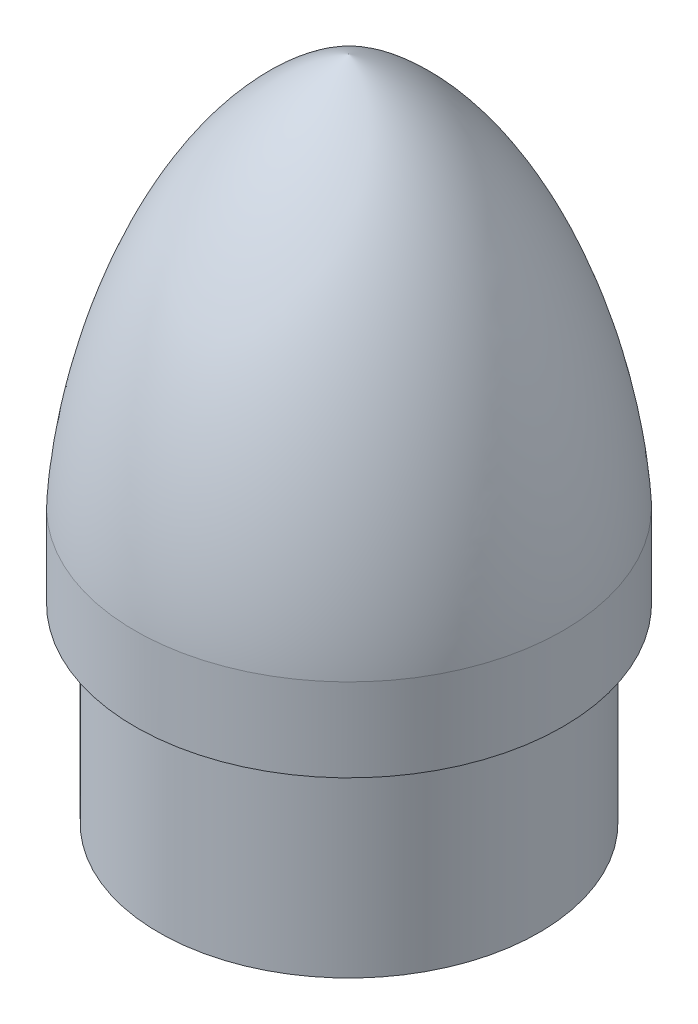
from build123d import *

# Parameters (mm, degrees)
SKETCH6_R           = 45
BOSS_EXTRUDE7_DEPTH = 100
SKETCH8_R           = 40
BOSS_EXTRUDE8_DEPTH = 40


with BuildPart() as part:
    # Sketch6 → Boss-Extrude7 (new body)
    with BuildSketch(Plane(origin=(0, 0, 0), x_dir=(1, 0, 0), z_dir=(0, 1, 0))):
        with Locations(Location((0, 0, 0), (0, 0, 270))):
            Circle(SKETCH6_R)
    extrude(amount=BOSS_EXTRUDE7_DEPTH)


with BuildPart() as body_2:
    # Sketch7 → Revolve2 (revolve)
    with BuildSketch(Plane.XY, mode=Mode.PRIVATE) as revolve2_sk:
        with BuildLine():
            Line((0, 100), (0, 125.083403494))
            Line((0, 125.083403494), (-88.216224583, 125.083403494))
            Line((-88.216224583, 125.083403494), (-88.216224583, 0))
            Line((-88.216224583, 0), (-45, 0))
            add(Edge.make_bspline(
                [(-45, 0), (-45.199870538, 9.069967987), (-45.686940304, 37.078388642), (-29.510811545, 88.131965608), (0, 100)],
                knots=[0, 0, 0, 0, 0.165319882, 1, 1, 1, 1], degree=3))
        make_face()
    revolve(revolve2_sk.sketch.rotate(Axis((0, 100, 0), (0, 1, 0)), 180), axis=Axis((0, 100, 0), (0, 1, 0)))


with BuildPart() as part_1:
    add(part.part)

    # Intersect1: read off the stored shape, not the designer's step
    # Intersect1: cut body 2
    add(body_2.part, mode=Mode.SUBTRACT)

    # Sketch8 → Boss-Extrude8 (add)
    with BuildSketch(Plane.XZ):
        with Locations(Location((0, 0, 0), (0, 0, 270))):
            Circle(SKETCH8_R)
    extrude(amount=BOSS_EXTRUDE8_DEPTH)


solid = part_1.part
